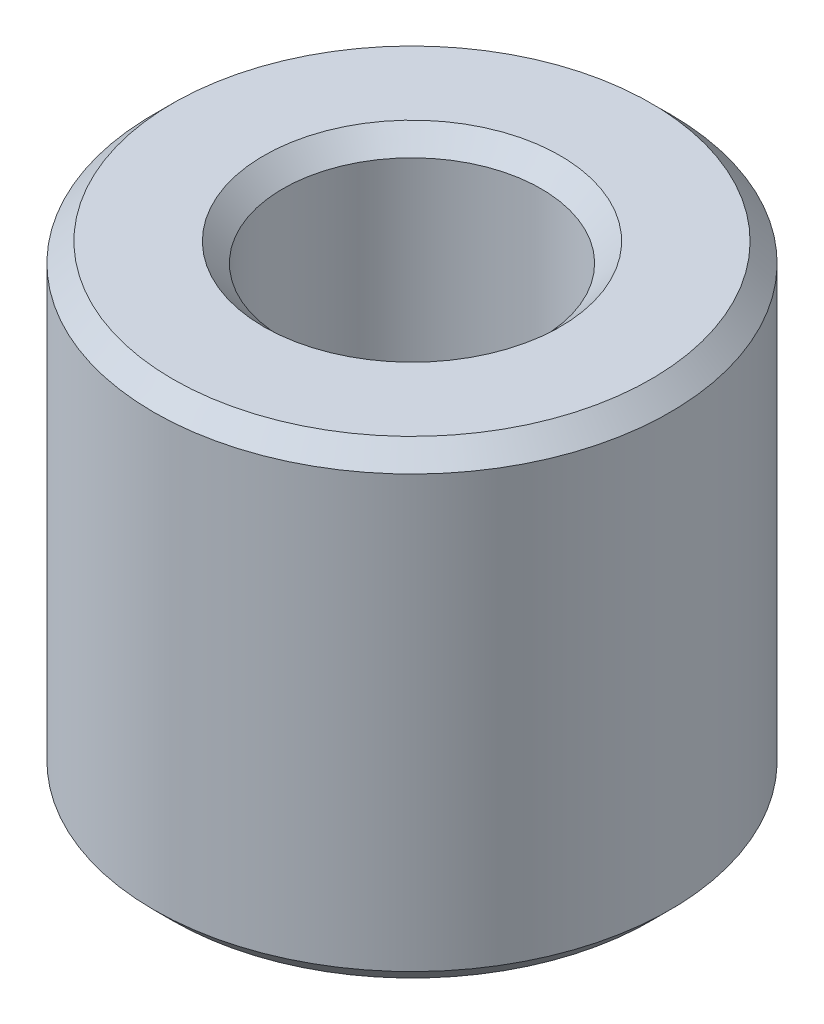
from build123d import *
from OCP.BRepFilletAPI import BRepFilletAPI_MakeChamfer

# Parameters (mm, degrees)
SKETCH1_R           = 37.5
BOSS_EXTRUDE1_DEPTH = 68.132829337
SKETCH2_R           = 18.759121223
CUT_EXTRUDE1_DEPTH  = 87.339923752
CHAMFER1_SIZE       = 2.773239225
CHAMFER1_SIZE2      = 2.775383275


with BuildPart() as part:
    # Sketch1 → Boss-Extrude1 (new body)
    with BuildSketch(Plane(origin=(0, 0, 0), x_dir=(1, 0, 0), z_dir=(0, 1, 0))):
        Circle(SKETCH1_R)
    extrude(amount=BOSS_EXTRUDE1_DEPTH)

    # Sketch2 → Cut-Extrude1 (cut, through all)
    with BuildSketch(Plane(origin=(0, 0, 0), x_dir=(1, 0, 0), z_dir=(0, 1, 0))):
        Circle(SKETCH2_R)
    extrude(amount=CUT_EXTRUDE1_DEPTH, mode=Mode.SUBTRACT)

    # Chamfer1: one chamfer whose edges measure the first distance from different faces: ONE call of the kernel's chamfer builder (chamfer() names one face for all edges)
    chamfer1_edges_1 = [part.edges().sort_by_distance(p)[0] for p in [
        (-18.759121223, 68.132829337, 0),
    ]]
    chamfer1_side_1 = [part.faces().sort_by_distance(p)[0] for p in [
        (-36.439339828, 68.132829337, 0),
    ]]
    chamfer1_edges_2 = [part.edges().sort_by_distance(p)[0] for p in [
        (-18.759121223, 0, 0),
    ]]
    chamfer1_side_2 = [part.faces().sort_by_distance(p)[0] for p in [
        (-18.759121223, 34.066414668, 0),
    ]]
    chamfer1_edges_3 = [part.edges().sort_by_distance(p)[0] for p in [
        (-37.5, 0, 0),
    ]]
    chamfer1_side_3 = [part.faces().sort_by_distance(p)[0] for p in [
        (-36.439339828, 0, 0),
    ]]
    chamfer1_edges_4 = [part.edges().sort_by_distance(p)[0] for p in [
        (-37.5, 68.132829337, 0),
    ]]
    chamfer1_side_4 = [part.faces().sort_by_distance(p)[0] for p in [
        (-37.5, 34.066414668, 0),
    ]]
    chamfer1 = BRepFilletAPI_MakeChamfer(part.part.solid().wrapped)
    for e in chamfer1_edges_1:
        chamfer1.Add(CHAMFER1_SIZE, CHAMFER1_SIZE2, e.wrapped, chamfer1_side_1[0].wrapped)  # the first distance lies on this face
    for e in chamfer1_edges_2:
        chamfer1.Add(CHAMFER1_SIZE, CHAMFER1_SIZE2, e.wrapped, chamfer1_side_2[0].wrapped)  # the first distance lies on this face
    for e in chamfer1_edges_3:
        chamfer1.Add(CHAMFER1_SIZE, CHAMFER1_SIZE2, e.wrapped, chamfer1_side_3[0].wrapped)  # the first distance lies on this face
    for e in chamfer1_edges_4:
        chamfer1.Add(CHAMFER1_SIZE, CHAMFER1_SIZE2, e.wrapped, chamfer1_side_4[0].wrapped)  # the first distance lies on this face
    add(Compound.cast(chamfer1.Shape()), mode=Mode.REPLACE)


solid = part.part
